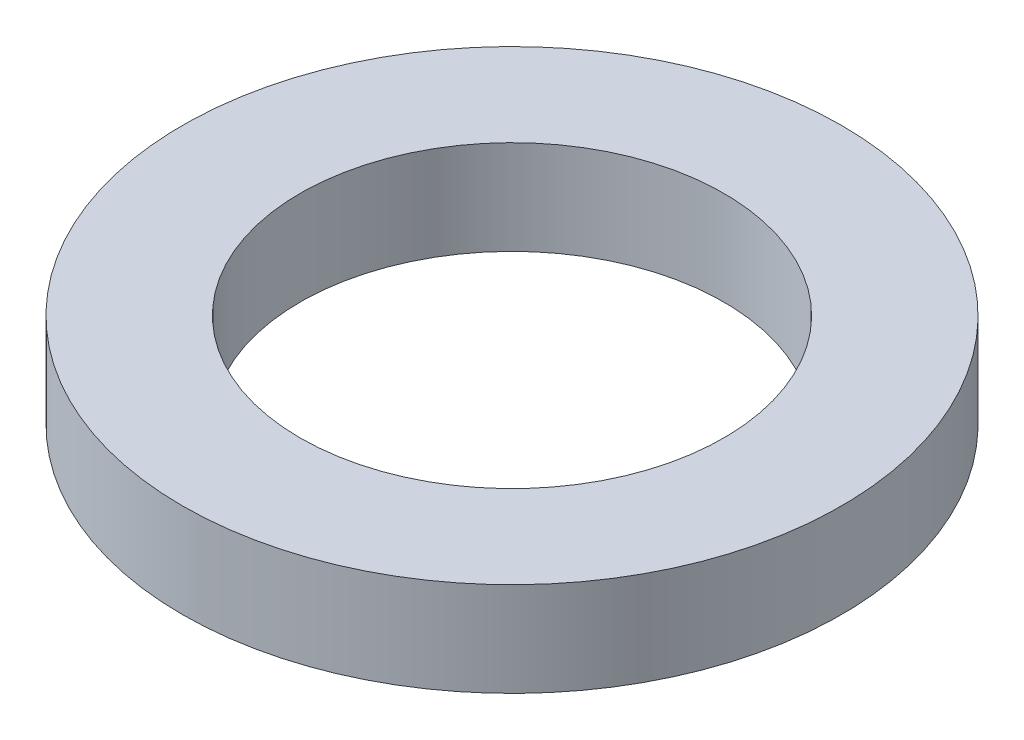
from build123d import *

# Parameters (mm, degrees)
SKETCH1_R           = 35
BOSS_EXTRUDE1_DEPTH = 10
SKETCH2_R           = 22.5
CUT_EXTRUDE1_DEPTH  = 51.497524692


with BuildPart() as part:
    # Sketch1 → Boss-Extrude1 (new body)
    with BuildSketch(Plane(origin=(0, 0, 0), x_dir=(1, 0, 0), z_dir=(0, 1, 0))):
        Circle(SKETCH1_R)
    extrude(amount=BOSS_EXTRUDE1_DEPTH)

    # Sketch2 → Cut-Extrude1 (cut, through all)
    with BuildSketch(Plane(origin=(0, 0, 0), x_dir=(1, 0, 0), z_dir=(0, 1, 0))):
        Circle(SKETCH2_R)
    extrude(amount=CUT_EXTRUDE1_DEPTH, mode=Mode.SUBTRACT)


solid = part.part
